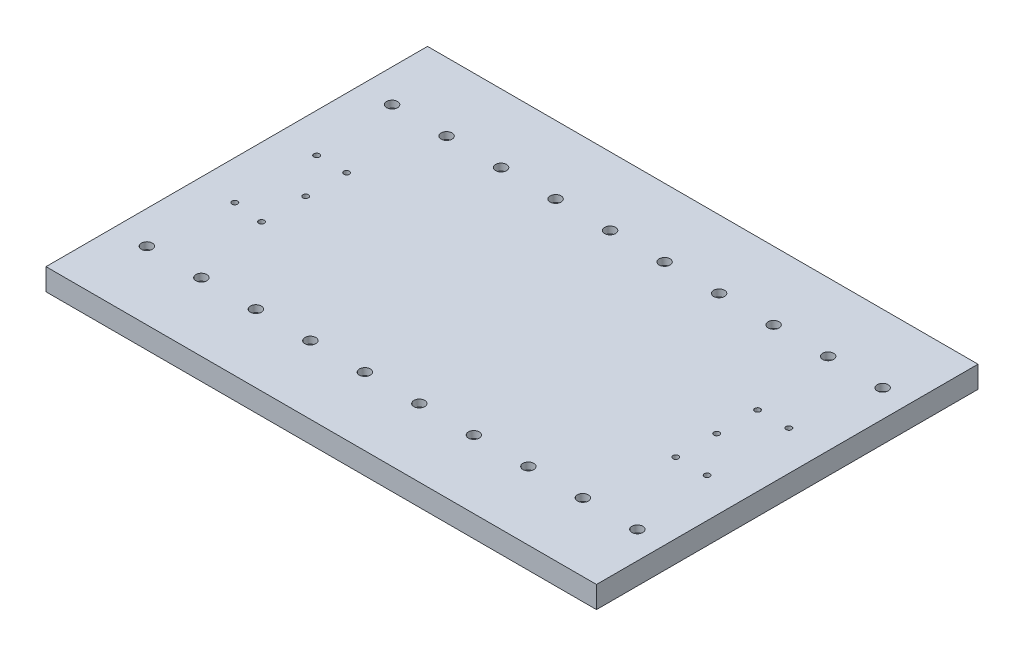
from build123d import *

# Parameters (mm, degrees)
SKETCH1_W                                            = 700
SKETCH1_H                                            = 40
BOSS_EXTRUDE1_DEPTH                                  = 505
M12_TAPPED_HOLE1_D                                   = 10.2
M12_TAPPED_HOLE1_DEPTH                               = 29.25
M12_TAPPED_HOLE1_TIP                                 = 3.064389157
CBORE_FOR_M12_HEX_SOCKET_HEAD_CAP_SCREW1_D           = 13
CBORE_FOR_M12_HEX_SOCKET_HEAD_CAP_SCREW1_CBORE_D     = 20
CBORE_FOR_M12_HEX_SOCKET_HEAD_CAP_SCREW1_CBORE_DEPTH = 12.6
LPATTERN1_COUNT                                      = 10
LPATTERN1_PITCH                                      = 100
LPATTERN1_COUNT_DIR2                                 = 2
LPATTERN1_PITCH_DIR2                                 = 450


with BuildPart() as part:
    # Sketch1 → Boss-Extrude1 (new, symmetric)
    with BuildSketch(Plane(origin=(0, 0, 0), x_dir=(0, 0, -1), z_dir=(1, 0, 0))):
        Rectangle(SKETCH1_W, SKETCH1_H)
    extrude(amount=BOSS_EXTRUDE1_DEPTH, both=True)

    # M12 Tapped Hole1
    with Locations(Plane(origin=(0, 20, 0), x_dir=(1, 0, 0), z_dir=(0, 1, 0))):
        with Locations((-378.5, 75.052013766), (-433.5, 75), (-378.5, -81.130993075), (-433.5, -75), (433, 75), (375.5, 75), (433, -75), (375.5, -75), (375.5, 0), (-378.5, 0)):
            Hole(M12_TAPPED_HOLE1_D / 2, depth=M12_TAPPED_HOLE1_DEPTH)
            with Locations((0, 0, -(M12_TAPPED_HOLE1_DEPTH + M12_TAPPED_HOLE1_TIP / 2))):  # 118° drill point
                Cone(0, M12_TAPPED_HOLE1_D / 2, M12_TAPPED_HOLE1_TIP, mode=Mode.SUBTRACT)

    # CBORE for M12 Hex Socket Head Cap Screw1 (through all)
    with Locations(Plane(origin=(0, 20, 0), x_dir=(1, 0, 0), z_dir=(0, 1, 0))):
        with Locations((455, -225)):
            cbore_for_m12_hex_socket_head_cap_screw1 = CounterBoreHole(CBORE_FOR_M12_HEX_SOCKET_HEAD_CAP_SCREW1_D / 2, CBORE_FOR_M12_HEX_SOCKET_HEAD_CAP_SCREW1_CBORE_D / 2, CBORE_FOR_M12_HEX_SOCKET_HEAD_CAP_SCREW1_CBORE_DEPTH)

    # LPattern1: CBORE for M12 Hex Socket Head Cap Screw1 10 × 2
    with Locations(*[(-i * LPATTERN1_PITCH, 0, -j * LPATTERN1_PITCH_DIR2) for i in range(LPATTERN1_COUNT) for j in range(LPATTERN1_COUNT_DIR2) if (i, j) != (0, 0)]):
        add(cbore_for_m12_hex_socket_head_cap_screw1, mode=Mode.SUBTRACT)


solid = part.part
